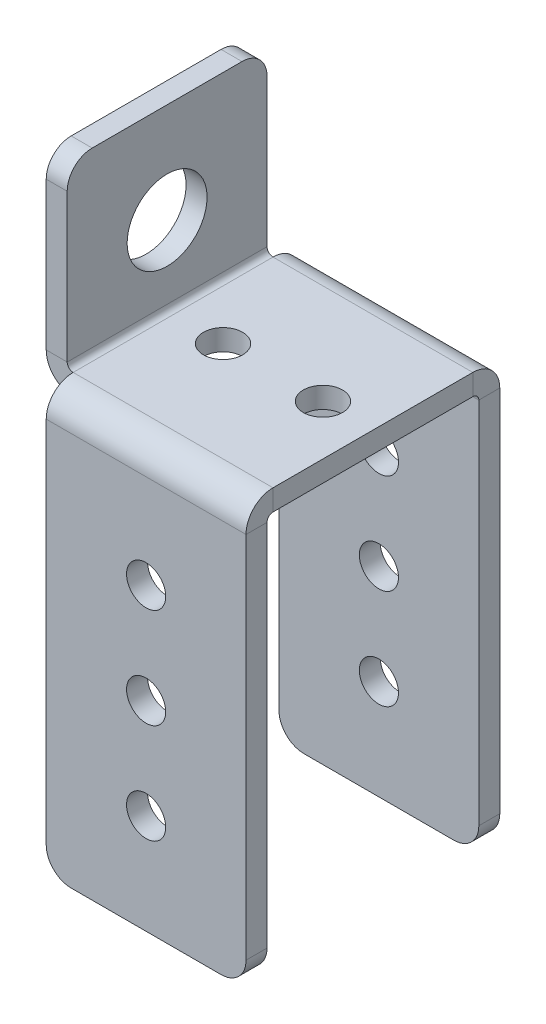
from build123d import *

# Parameters (mm, degrees)
BASE_FLANGE1_START = -12.7
BASE_FLANGE1_DEPTH = 25.4
EDGE_FLANGE1_DEPTH = 25.4
SKETCH9_R          = 5.08
CUT_EXTRUDE1_DEPTH = 86.828419099
SKETCH10_R         = 2.4892
CUT_EXTRUDE2_DEPTH = 85.303992818
CUT_EXTRUDE3_REACH = 65.202
SKETCH11_R         = 2.4892
FILLET1_R          = 3.175


# Read off the part's stored shape, not the designer's step: Base-Flange1
# Sheet-metal steps are written as plain solids
with BuildPart() as part:
    # Base-Flange1 outline → Base-Flange1 (new body)
    with BuildSketch(Plane(origin=(0, 0, 0), x_dir=(0, 0, -1), z_dir=(1, 0, 0)).offset(BASE_FLANGE1_START)):
        with BuildLine():
            Line((26.924, 50.038), (26.924, 0))
            Line((26.924, 0), (29.591, 0))
            Line((29.591, 0), (29.591, 50.038))
            ThreePointArc((29.591, 50.038), (28.586669153, 52.462669153), (26.162, 53.467))
            Line((26.162, 53.467), (0.762, 53.467))
            ThreePointArc((0.762, 53.467), (-1.662669153, 52.462669153), (-2.667, 50.038))
            Line((-2.667, 50.038), (-2.667, 0))
            Line((-2.667, 0), (0, 0))
            Line((0, 0), (0, 50.038))
            ThreePointArc((0, 50.038), (0.223184633, 50.576815367), (0.762, 50.8))
            Line((0.762, 50.8), (26.162, 50.8))
            ThreePointArc((26.162, 50.8), (26.700815367, 50.576815367), (26.924, 50.038))
        make_face()
    extrude(amount=BASE_FLANGE1_DEPTH)

    # Edge-Flange1 section (across the edge) → Edge-Flange1 (add)
    with BuildSketch(Plane(origin=(-13.462, 53.467, -26.162), x_dir=(1, 0, 0), z_dir=(0, 0, 1))):
        with BuildLine():
            Line((-2.667, 0.762), (-2.667, 22.733))
            Line((-2.667, 22.733), (0, 22.733))
            Line((0, 22.733), (0, 0.762))
            ThreePointArc((0, 0.762), (0.223184633, 0.223184633), (0.762, 0))
            Line((0.762, 0), (0.762, -2.667))
            ThreePointArc((0.762, -2.667), (-1.662669153, -1.662669153), (-2.667, 0.762))
        make_face()
    extrude(amount=EDGE_FLANGE1_DEPTH)

    # Sketch9 → Cut-Extrude1 (cut, through all)
    with BuildSketch(Plane(origin=(-13.462, 0, 0), x_dir=(0, 0, -1), z_dir=(1, 0, 0))):
        with Locations(Location((13.462, 63.5, 0), (0, 0, 90))):
            Circle(SKETCH9_R)
    extrude(amount=-CUT_EXTRUDE1_DEPTH, mode=Mode.SUBTRACT)

    # Sketch10 → Cut-Extrude2 (cut, through all)
    with BuildSketch(Plane.XY.offset(2.667)):
        with Locations((0, 12.7)):
            Circle(SKETCH10_R)
        with Locations((0, 25.4)):
            Circle(SKETCH10_R)
        with Locations((0, 38.1)):
            Circle(SKETCH10_R)
    extrude(amount=-CUT_EXTRUDE2_DEPTH, mode=Mode.SUBTRACT)

    # Sketch11 → Cut-Extrude3 (cut, up to next)
    with BuildSketch(Plane(origin=(0, 53.467, 0), x_dir=(1, 0, 0), z_dir=(0, 1, 0)), mode=Mode.PRIVATE) as cut_extrude3_sk1:
        with Locations(Location((-6.35, 13.462, 0), (0, 0, 270))):
            Circle(SKETCH11_R)
    cut_extrude3_tool1 = extrude(cut_extrude3_sk1.sketch, amount=-CUT_EXTRUDE3_REACH, mode=Mode.PRIVATE) & part.part
    # Sketch11 → Cut-Extrude3 (cut, up to next)
    with BuildSketch(Plane(origin=(0, 53.467, 0), x_dir=(1, 0, 0), z_dir=(0, 1, 0)), mode=Mode.PRIVATE) as cut_extrude3_sk2:
        with Locations(Location((6.35, 13.462, 0), (0, 0, 270))):
            Circle(SKETCH11_R)
    cut_extrude3_tool2 = extrude(cut_extrude3_sk2.sketch, amount=-CUT_EXTRUDE3_REACH, mode=Mode.PRIVATE) & part.part
    add(cut_extrude3_tool1.solids().sort_by_distance((-6.35, 53.467, -13.462))[0], mode=Mode.SUBTRACT)
    add(cut_extrude3_tool2.solids().sort_by_distance((6.35, 53.467, -13.462))[0], mode=Mode.SUBTRACT)

    # Fillet1
    fillet1_edges = [part.edges().sort_by_distance(p)[0] for p in [
        (-12.7, 0, 1.3335),
        (-12.7, 0, -28.2575),
        (12.7, 0, 1.3335),
        (-14.7955, 76.2, -26.162),
        (-14.7955, 76.2, -0.762),
        (12.7, 0, -28.2575),
    ]]
    fillet(fillet1_edges, radius=FILLET1_R)


solid = part.part
